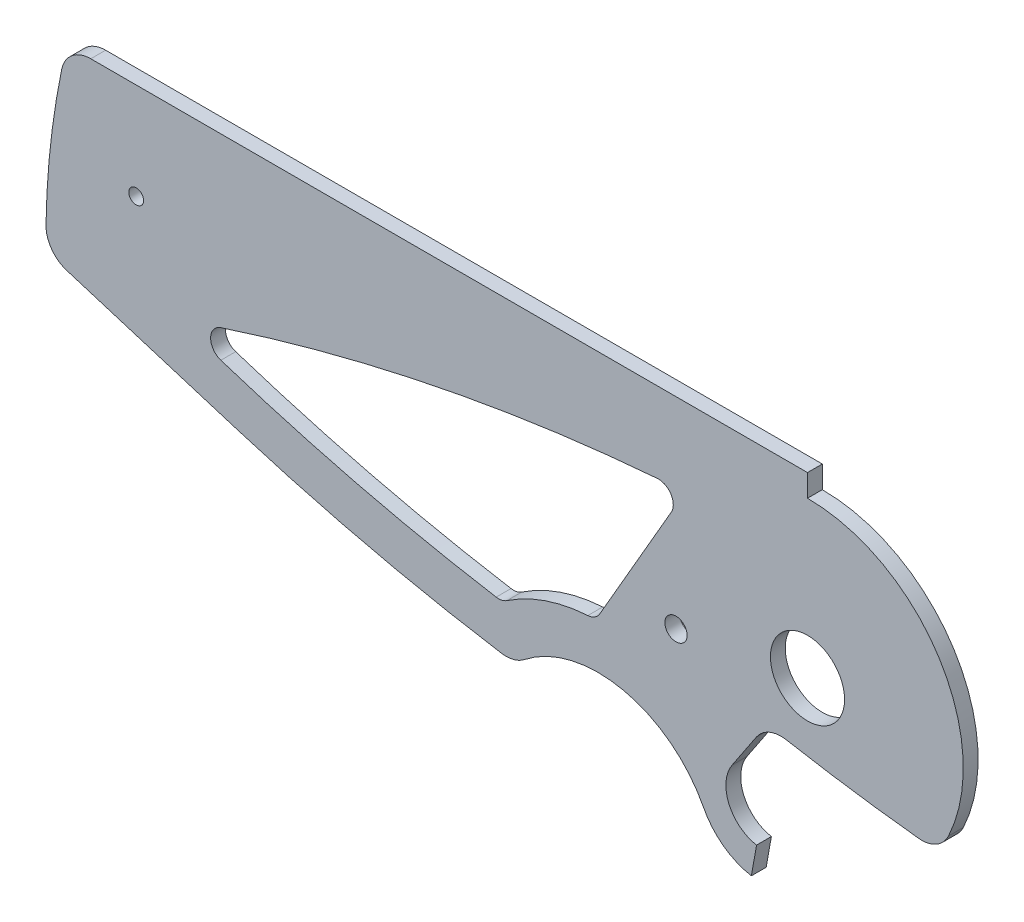
from build123d import *

# Parameters (mm, degrees)
SKICA1_R                 = 2.5
P_IDAT_VYSUNUT_M1_DEPTH  = 1
SKICA2_R                 = 0.75
SKICA2_R_2               = 0.5
ODEBRAT_VYSUNUT_M2_DEPTH = 54.064245505
ODEBRAT_VYSUNUT_M3_DEPTH = 54.064245505


with BuildPart() as part:
    # Skica1 → Přidat vysunutím1 (new body)
    with BuildSketch(Plane.XY):
        with BuildLine():
            Line((-3.451850397, -5.17306034), (-5.079542319, -7.612374783))
            ThreePointArc((-5.079542319, -7.612374783), (-5.298818394, -9.982565006), (-3.434120444, -11.462019383))
            Line((-3.434120444, -11.462019383), (-3.7814168, -13.431634889))
            ThreePointArc((-3.7814168, -13.431634889), (-5.668297006, -12.623560554), (-7, -11.061552813))
            ThreePointArc((-7, -11.061552813), (-12.421451418, -6.907005546), (-19.074569669, -8.452455647))
            ThreePointArc((-19.074569669, -8.452455647), (-19.810429728, -8.819128255), (-20.631627839, -8.858782909))
            ThreePointArc((-20.631627839, -8.858782909), (-29.612816832, -7.095755552), (-38.448343472, -4.707557447))
            Line((-38.448343472, -4.707557447), (-49.915705076, -1.172077587))
            ThreePointArc((-49.915705076, -1.172077587), (-50.944425281, -0.436513563), (-51.326233925, 0.769115673))
            ThreePointArc((-51.326233925, 0.769115673), (-51.024263074, 5.612344033), (-50.266302206, 10.405416394))
            ThreePointArc((-50.266302206, 10.405416394), (-49.570592062, 11.550940487), (-48.307823831, 12))
            Line((-48.307823831, 12), (0, 12))
            Line((0, 12), (0, 10.5))
            ThreePointArc((0, 10.5), (8.864205709, 5.628130874), (9.502649492, -4.466503402))
            ThreePointArc((9.502649492, -4.466503402), (8.672376262, -5.35932327), (7.478006155, -5.604192624))
            ThreePointArc((7.478006155, -5.604192624), (3.01210543, -5.04033823), (-1.430493256, -4.315412042))
            ThreePointArc((-1.430493256, -4.315412042), (-2.569395622, -4.442030631), (-3.451850397, -5.17306034))
        make_face()
        Circle(SKICA1_R, mode=Mode.SUBTRACT)
    extrude(amount=P_IDAT_VYSUNUT_M1_DEPTH)

    # Skica2 → Odebrat vysunutím2 (cut, through all)
    with BuildSketch(Plane.XY):
        with Locations((-8.863269777, -1.562833599)):
            Circle(SKICA2_R)
        with Locations((-45.246630015, 5.5)):
            Circle(SKICA2_R_2)
    extrude(amount=ODEBRAT_VYSUNUT_M2_DEPTH, mode=Mode.SUBTRACT)

    # Skica14 → Odebrat vysunutím3 (cut, through all)
    with BuildSketch(Plane.XY):
        with BuildLine():
            Line((-14.000954762, -3.250365002), (-9.180543984, 5.098831378))
            ThreePointArc((-9.180543984, 5.098831378), (-9.201183144, 6.132986878), (-10.126304066, 6.5956475))
            ThreePointArc((-10.126304066, 6.5956475), (-25.0093231, 4.513187085), (-39.5421575, 0.687272652))
            ThreePointArc((-39.5421575, 0.687272652), (-40.23080172, -0.263668209), (-39.540926846, -1.21371665))
            ThreePointArc((-39.540926846, -1.21371665), (-30.346748023, -3.835878825), (-20.981929874, -5.761713644))
            ThreePointArc((-20.981929874, -5.761713644), (-20.60514794, -5.752569661), (-20.258511168, -5.604612957))
            ThreePointArc((-20.258511168, -5.604612957), (-17.654944999, -4.313023149), (-14.803991078, -3.748379218))
            ThreePointArc((-14.803991078, -3.748379218), (-14.339939825, -3.600205269), (-14.000954762, -3.250365002))
        make_face()
    extrude(amount=ODEBRAT_VYSUNUT_M3_DEPTH, mode=Mode.SUBTRACT)


solid = part.part
